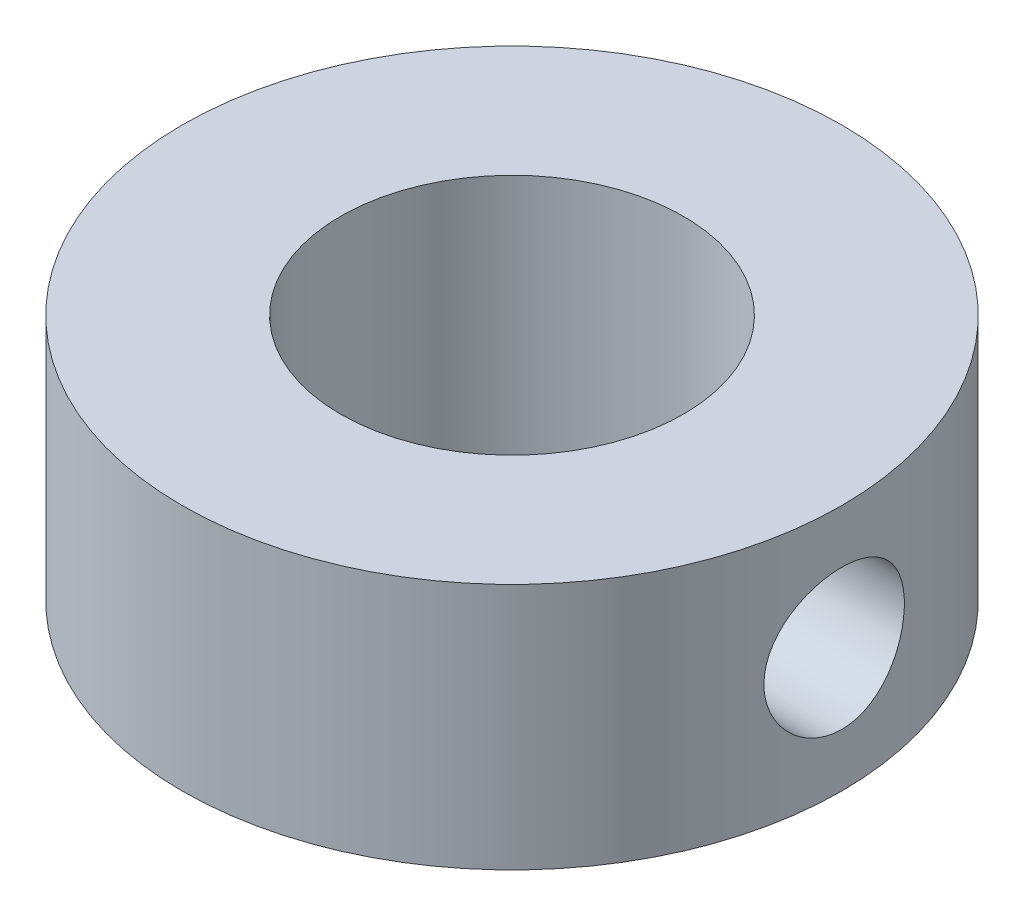
from build123d import *

# Parameters (mm, degrees)
SKETCH1_R           = 6.35
SKETCH1_R_2         = 3.302
BOSS_EXTRUDE1_DEPTH = 4.7625
SKETCH3_W           = 1.35255
SKETCH3_H           = 6.35


with BuildPart() as part:
    # Sketch1 → Boss-Extrude1 (new body)
    with BuildSketch(Plane(origin=(0, 0, 0), x_dir=(1, 0, 0), z_dir=(0, 1, 0))):
        Circle(SKETCH1_R)
        Circle(SKETCH1_R_2, mode=Mode.SUBTRACT)
    extrude(amount=BOSS_EXTRUDE1_DEPTH)

    # Sketch3 → #6-32 Tapped Hole1 (revolve, cut)
    with BuildSketch(Plane.ZX.offset(2.38125)):
        with Locations((0.676275, 3.175)):
            Rectangle(SKETCH3_W, SKETCH3_H)
    revolve(axis=Axis((-6.35, 2.38125, 0), (1, 0, 0)), mode=Mode.SUBTRACT)


solid = part.part
